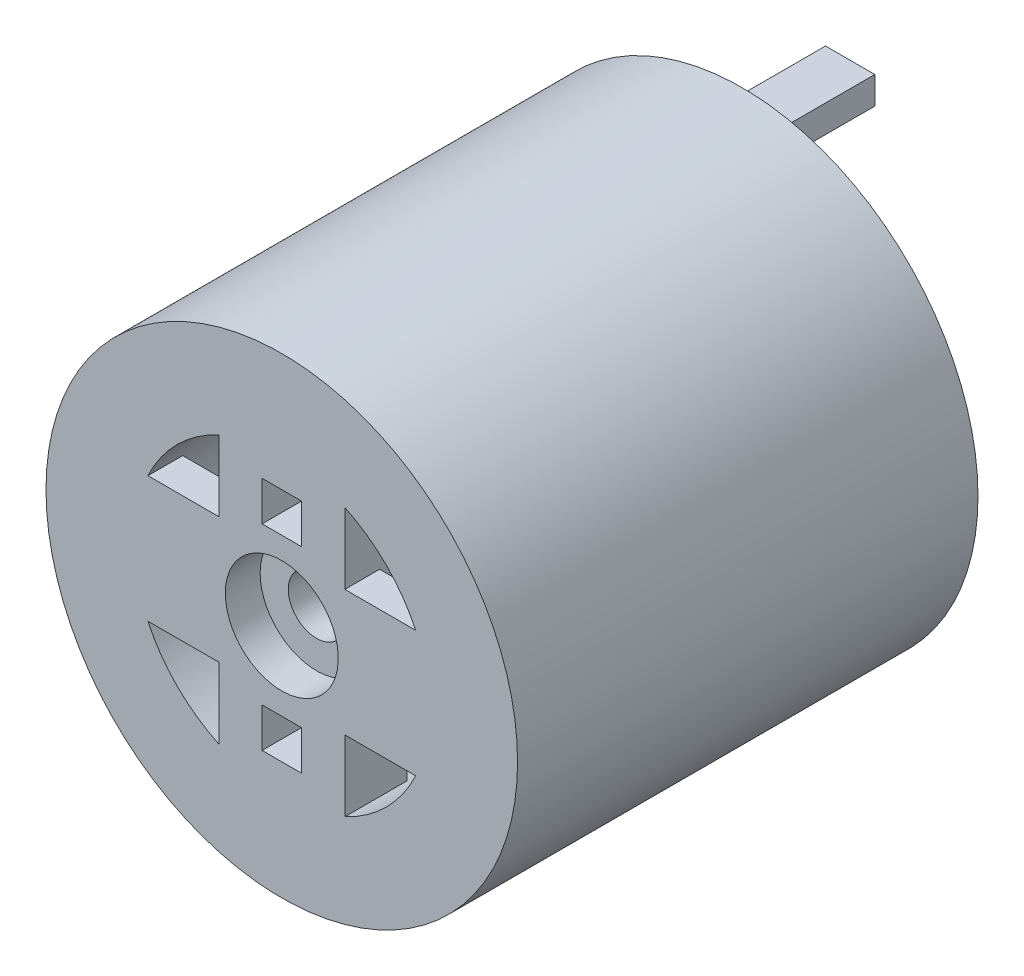
from build123d import *

# Parameters (mm, degrees)
SKETCH1_R                       = 21.51
BOSS_EXTRUDE1_DEPTH             = 42
SKETCH1_4_W                     = 4.5
SKETCH1_4_H                     = 2.5
BOSS_EXTRUDE2_DEPTH             = 9.85
CIRPATTERN2_COUNT               = 2
BOSS_EXTRUDE3_DEPTH             = 3.175
CUT_EXTRUDE2_DEPTH              = 61.114746111
CUT_EXTRUDE2_DEPTH_BACK         = 5
SKETCH7_R                       = 5.15
SKETCH8_W                       = 11.49524473
SKETCH8_H                       = 32.96460859
SKETCH8_R                       = 2.5875
BOSS_EXTRUDE4_DEPTH             = 2.5
CUT_EXTRUDE1_DEPTH              = 23
CIRPATTERN1_COUNT               = 2
CIRPATTERN1_ANGLE               = 53
CIRPATTERN1_THE_OTHER_WAY_COUNT = 2
CIRPATTERN1_THE_OTHER_WAY_ANGLE = 53
MIRROR2_COPY_1_DEPTH            = 23
MIRROR2_COPY_2_DEPTH            = 23
MIRROR2_COPY_3_DEPTH            = 23
CUT_EXTRUDE21_DEPTH             = 29


with BuildPart() as part:
    # Sketch1 → Boss-Extrude1 (new body)
    with BuildSketch(Plane.XY):
        Circle(SKETCH1_R)
        with BuildLine():
            ThreePointArc((0, 13.500344823), (9.546185373, 9.546185373), (13.500344823, 0))
            ThreePointArc((13.500344823, 0), (9.546185373, -9.546185373), (0, -13.500344823))
            ThreePointArc((0, -13.500344823), (-13.500344823, 0), (0, 13.500344823))
        make_face(mode=Mode.SUBTRACT)
    extrude(amount=BOSS_EXTRUDE1_DEPTH)

    # Sketch1<4> → Boss-Extrude2 (add)
    with BuildSketch(Plane.XY):
        with Locations((0, 17.500344823)):
            Rectangle(SKETCH1_4_W, SKETCH1_4_H)
    boss_extrude2 = extrude(amount=-BOSS_EXTRUDE2_DEPTH)

    # CirPattern2: Boss-Extrude2 ×2 about axis
    cirpattern2_axis = Axis((0, 0, 26.501422175), (0, 0, -1))
    for i in range(1, CIRPATTERN2_COUNT):
        add(boss_extrude2.rotate(cirpattern2_axis, i * 360 / CIRPATTERN2_COUNT))

    # Sketch4 → Boss-Extrude3 (add)
    with BuildSketch(Plane.XY.offset(42)):
        Polygon((-5.747622365, -18.82107696), (5.747622365, -18.82107696), (5.747622365, -5.747622365), (18.82107696, -5.747622365), (18.82107696, 5.747622365), (5.747622365, 5.747622365), (5.747622365, 18.82107696), (-5.747622365, 18.82107696), (-5.747622365, 5.747622365), (-18.82107696, 5.747622365), (-18.82107696, -5.747622365), (-5.747622365, -5.747622365), align=None)
    extrude(amount=-BOSS_EXTRUDE3_DEPTH)

    # Sketch7 → Cut-Extrude2 (cut, two sides: drawn at the far end of the back side and taken through both)
    with BuildSketch(Plane.XY.offset(42).offset(-CUT_EXTRUDE2_DEPTH_BACK)):
        Circle(SKETCH7_R)
    extrude(amount=CUT_EXTRUDE2_DEPTH + CUT_EXTRUDE2_DEPTH_BACK, mode=Mode.SUBTRACT)

    # Sketch8 → Boss-Extrude4 (add)
    with BuildSketch(Plane.XY.offset(38.825)):
        Rectangle(SKETCH8_W, SKETCH8_H)
        Circle(SKETCH8_R, mode=Mode.SUBTRACT)
    extrude(amount=-BOSS_EXTRUDE4_DEPTH)

    # Sketch1<3> → Cut-Extrude1 (cut)
    with BuildSketch(Plane.XY):
        Polygon((14.534826762, 4.999881098), (14.500344823, 0), (14.465862885, -4.999881098), (19.465743983, -5.034363037), (19.53470786, 4.96539916), align=None)
    cut_extrude1 = extrude(amount=CUT_EXTRUDE1_DEPTH, mode=Mode.SUBTRACT)

    # CirPattern1: Cut-Extrude1 ×2 about axis
    cirpattern1_axis = Axis((0, 0, 26.501422175), (0, 0, 1))
    for i in range(1, CIRPATTERN1_COUNT):
        add(cut_extrude1.rotate(cirpattern1_axis, i * CIRPATTERN1_ANGLE / (CIRPATTERN1_COUNT - 1)), mode=Mode.SUBTRACT)

    # CirPattern1 the other way: Cut-Extrude1 ×2 about axis
    cirpattern1_the_other_way_axis = Axis((0, 0, 26.501422175), (0, 0, -1))
    for i in range(1, CIRPATTERN1_THE_OTHER_WAY_COUNT):
        add(cut_extrude1.rotate(cirpattern1_the_other_way_axis, i * CIRPATTERN1_THE_OTHER_WAY_ANGLE / (CIRPATTERN1_THE_OTHER_WAY_COUNT - 1)), mode=Mode.SUBTRACT)

    # Mirror2 copy 1 sketch → Mirror2 copy 1 (cut)
    with BuildSketch(Plane(origin=(0, 0, 0), x_dir=(-0.6018150231520466, 0.798635510047294, 0), z_dir=(0, 0, 1))):
        Polygon((14.534826762, -4.999881098), (14.500344823, 0), (14.465862885, 4.999881098), (19.465743983, 5.034363037), (19.53470786, -4.96539916), align=None)
    extrude(amount=MIRROR2_COPY_1_DEPTH, mode=Mode.SUBTRACT)

    # Mirror2 copy 2 sketch → Mirror2 copy 2 (cut)
    with BuildSketch(Plane(origin=(0, 0, 0), x_dir=(-0.6018150231520466, -0.798635510047294, 0), z_dir=(0, 0, 1))):
        Polygon((14.534826762, -4.999881098), (14.500344823, 0), (14.465862885, 4.999881098), (19.465743983, 5.034363037), (19.53470786, -4.96539916), align=None)
    extrude(amount=MIRROR2_COPY_2_DEPTH, mode=Mode.SUBTRACT)

    # Mirror2 copy 3 sketch → Mirror2 copy 3 (cut)
    with BuildSketch(Plane(origin=(0, 0, 0), x_dir=(-1, 0, 0), z_dir=(0, 0, 1))):
        Polygon((14.534826762, -4.999881098), (14.500344823, 0), (14.465862885, 4.999881098), (19.465743983, 5.034363037), (19.53470786, -4.96539916), align=None)
    extrude(amount=MIRROR2_COPY_3_DEPTH, mode=Mode.SUBTRACT)

    # Sketch11 → Cut-Extrude21 (cut)
    with BuildSketch(Plane(origin=(0, 0, 42), x_dir=(-1, 0, 0), z_dir=(0, 0, -1))):
        Polygon((1.8, 10.75), (-1.8, 10.75), (-1.8, 7.15), (0, 7.15), (1.8, 7.15), align=None)
    cut_extrude21 = extrude(amount=CUT_EXTRUDE21_DEPTH, mode=Mode.SUBTRACT)

    # Mirror1: Cut-Extrude21 across plane
    add(cut_extrude21.mirror(Plane.ZX), mode=Mode.SUBTRACT)


solid = part.part
